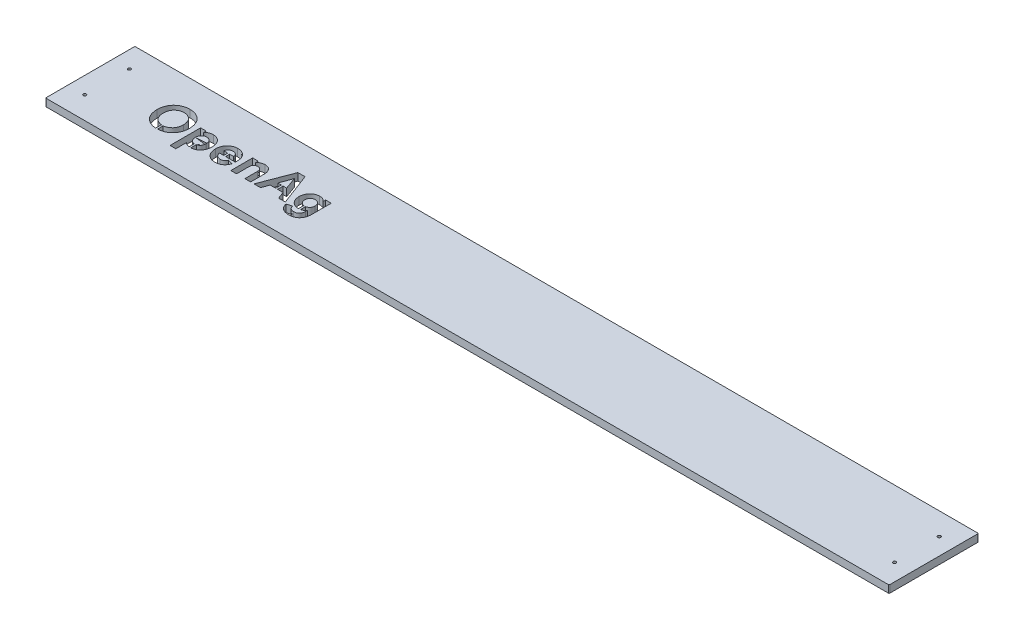
from build123d import *

# Parameters (mm, degrees)
SKETCH1_W                       = 1439.06875
SKETCH1_H                       = 152.4
BOSS_EXTRUDE1_DEPTH             = 12.7
CUT_EXTRUDE1_START              = -12.7
CUT_EXTRUDE1_DEPTH              = 12.7
CUT_EXTRUDE1_2_DEPTH            = 12.7
CUT_EXTRUDE1_3_DEPTH            = 12.7
CUT_EXTRUDE1_4_DEPTH            = 12.7
CUT_EXTRUDE1_5_DEPTH            = 12.7
CUT_EXTRUDE1_6_DEPTH            = 12.7
SKETCH4_W                       = 3.175
SKETCH4_H                       = 6.933464818
SKETCH4_H_2                     = 9.654789964
BOSS_EXTRUDE2_DEPTH             = 12.7
SKETCH6_W                       = 2.5527
SKETCH6_H                       = 12.7005
F_10_CLEARANCE_HOLE1_AT_2_COUNT = 2
F_10_CLEARANCE_HOLE1_AT_2_PITCH = 76.2
F_10_CLEARANCE_HOLE1_AT_3_COUNT = 2
F_10_CLEARANCE_HOLE1_AT_3_PITCH = 1381.53775
F_10_CLEARANCE_HOLE1_AT_4_COUNT = 2
F_10_CLEARANCE_HOLE1_AT_4_PITCH = 1383.637595136
FILLET1_R                       = 1.27


with BuildPart() as part:
    # Sketch1 → Boss-Extrude1 (new body)
    with BuildSketch(Plane(origin=(0, 0, 0), x_dir=(1, 0, 0), z_dir=(0, 1, 0))):
        Rectangle(SKETCH1_W, SKETCH1_H)
    extrude(amount=BOSS_EXTRUDE1_DEPTH)

    # Cut-Extrude1: read off the stored shape, not the designer's step
    # Cut-Extrude1 outline → Cut-Extrude1 (cut)
    with BuildSketch(Plane(origin=(0, 12.7, 0), x_dir=(1, 0, 0), z_dir=(0, 1, 0)).offset(CUT_EXTRUDE1_START)):
        with BuildLine():
            add(Edge.make_bspline(
                [(-551.780401667, 1.668650361), (-551.827730252, 2.779667487), (-551.920081094, 4.947561717), (-552.36913896, 8.092172539), (-553.035642453, 11.045271373), (-553.945017943, 13.800583556), (-555.113751057, 16.352952069), (-556.499009185, 18.71730383), (-558.148142554, 20.869484112), (-560.012129529, 22.814369598), (-562.043963828, 24.552598477), (-564.217847515, 26.055813795), (-566.500187034, 27.342688771), (-568.899085055, 28.410338793), (-571.426107896, 29.219768884), (-574.058331807, 29.81667496), (-576.80690109, 30.189590968), (-578.678880612, 30.242403178), (-579.631574087, 30.269280527)],
                knots=[0, 0, 0, 0, 0.074451698, 0.145275354, 0.212435047, 0.277026598, 0.339247025, 0.400149219, 0.460197701, 0.520422419, 0.580293641, 0.639001946, 0.697181776, 0.755576162, 0.814566439, 0.874625005, 0.936193779, 1, 1, 1, 1], degree=3))
            add(Edge.make_bspline(
                [(-579.631574087, 30.269280527), (-580.580596553, 30.242403196), (-582.445262357, 30.189593865), (-585.182889168, 29.816724378), (-587.804026451, 29.219619511), (-590.320479117, 28.41080598), (-592.709887928, 27.339359027), (-594.989053596, 26.05955276), (-597.154037116, 24.548697395), (-599.185194957, 22.814872165), (-601.048993979, 20.8694434), (-602.697236606, 18.716964514), (-604.085550493, 16.355700015), (-605.238945284, 13.797790122), (-606.147925914, 11.044079391), (-606.831509792, 8.093797267), (-607.275924262, 4.947344025), (-607.36894565, 2.779593725), (-607.416617882, 1.668650361)],
                knots=[0, 0, 0, 0, 0.063651868, 0.125064965, 0.184969653, 0.243810466, 0.302063601, 0.360327161, 0.418917648, 0.478875035, 0.539186426, 0.599321328, 0.660311171, 0.7225192, 0.787203709, 0.854515571, 0.925441154, 1, 1, 1, 1], degree=3))
            Line((-607.416617882, 1.668650361), (-607.405607208, 1.676744229))
            add(Edge.make_bspline(
                [(-607.405607208, 1.676744229), (-607.362981179, 0.56666369), (-607.28004229, -1.593257081), (-606.829215936, -4.726852945), (-606.15038728, -7.659921304), (-605.236396522, -10.397425572), (-604.085705946, -12.94154698), (-602.697186075, -15.292035195), (-601.048045612, -17.432395297), (-599.189144597, -19.36911496), (-597.146368674, -21.077205409), (-594.992762301, -22.59218391), (-592.709177686, -23.859153484), (-590.317873035, -24.916201168), (-587.805914325, -25.732218166), (-585.181130627, -26.31011784), (-582.445514042, -26.688050022), (-580.580681443, -26.740144657), (-579.631574087, -26.766658243)],
                knots=[0, 0, 0, 0, 0.074679285, 0.145305977, 0.212557996, 0.276947572, 0.339097607, 0.400038707, 0.460138845, 0.520433742, 0.580232384, 0.638980237, 0.697279435, 0.755589107, 0.814587958, 0.874599129, 0.936177172, 1, 1, 1, 1], degree=3))
            add(Edge.make_bspline(
                [(-579.631574087, -26.766658243), (-578.678796075, -26.740144742), (-576.806650443, -26.688047471), (-574.060083368, -26.310065667), (-571.42422787, -25.732371548), (-568.9016789, -24.91572744), (-566.50092333, -23.862458879), (-564.214127552, -22.58846031), (-562.051654522, -21.081077871), (-560.008179286, -19.368613543), (-558.149091781, -17.43243533), (-556.499057175, -15.292376189), (-555.113598728, -12.938790008), (-553.947546219, -10.40022293), (-553.033371644, -7.661104411), (-552.370716796, -4.725265645), (-551.919140999, -1.595772685), (-551.827466232, 0.561259623), (-551.780401667, 1.668650361)],
                knots=[0, 0, 0, 0, 0.06398796, 0.1257321, 0.185907606, 0.245065904, 0.303527205, 0.361752053, 0.420627577, 0.480349956, 0.540567957, 0.600591448, 0.661454828, 0.723628057, 0.787935517, 0.855045975, 0.925582596, 1, 1, 1, 1], degree=3))
        make_face()
        with BuildLine():
            add(Edge.make_bspline(
                [(-330.194412628, -21.759384576), (-330.208076706, -22.212640523), (-330.234420309, -23.086493487), (-330.348511142, -24.349033425), (-330.562199308, -25.516234473), (-330.842828665, -26.594743382), (-331.205092001, -27.582283137), (-331.649497195, -28.472599023), (-332.16824851, -29.276871133), (-332.779649263, -29.985132757), (-333.466114792, -30.605302794), (-334.224179227, -31.136047772), (-335.044670216, -31.594410339), (-335.944716081, -31.958214676), (-336.915046175, -32.227453117), (-337.950543377, -32.42657124), (-339.056215692, -32.551866299), (-339.819441942, -32.55982935), (-340.212888501, -32.563934338)],
                knots=[0, 0, 0, 0, 0.080485407, 0.155171513, 0.224755314, 0.290873224, 0.352772413, 0.411099132, 0.467169437, 0.522198618, 0.57668027, 0.630958603, 0.686126708, 0.743163262, 0.802819978, 0.86459194, 0.930196537, 1, 1, 1, 1], degree=3))
            add(Edge.make_bspline(
                [(-340.212888501, -32.563934338), (-340.792226651, -32.53190261), (-341.909992615, -32.470101094), (-343.499373221, -32.06378618), (-344.925730518, -31.424871087), (-346.157413157, -30.527153426), (-347.202802671, -29.443384083), (-348.024950233, -28.18235562), (-348.625590947, -26.762433296), (-348.834379364, -25.746615916), (-348.941866956, -25.223657001)],
                knots=[0, 0, 0, 0, 0.139100388, 0.268378112, 0.391588743, 0.512334912, 0.632171462, 0.751372702, 0.872002719, 1, 1, 1, 1], degree=3))
            Line((-348.941866956, -25.223657001), (-357.703920487, -27.747469307))
            add(Edge.make_bspline(
                [(-357.703920487, -27.747469307), (-357.631334722, -28.216796793), (-357.487756269, -29.145151205), (-357.065147311, -30.481688653), (-356.583671059, -31.782938149), (-355.943128129, -33.01512336), (-355.207371288, -34.207907848), (-354.327153338, -35.323572678), (-353.355239754, -36.407367077), (-352.256135514, -37.410463244), (-351.055321054, -38.345300439), (-349.743771427, -39.153396815), (-348.34198851, -39.859360157), (-346.840552198, -40.427104684), (-345.239539697, -40.880048936), (-343.548201296, -41.217280726), (-341.7579574, -41.443912491), (-340.533195192, -41.489785876), (-339.904288253, -41.513341542)],
                knots=[0, 0, 0, 0, 0.057804303, 0.114339947, 0.170478657, 0.226758305, 0.283295723, 0.341073517, 0.399726364, 0.460579359, 0.522206872, 0.58496307, 0.648050758, 0.713256672, 0.780308064, 0.850658248, 0.923314041, 1, 1, 1, 1], degree=3))
            add(Edge.make_bspline(
                [(-339.904288253, -41.513341542), (-339.065663127, -41.474736612), (-337.441481474, -41.399969688), (-335.098863428, -41.081727674), (-332.93499337, -40.589566318), (-330.956283349, -39.922064403), (-329.157776173, -39.077050029), (-327.53687691, -38.064005697), (-326.102809853, -36.864772629), (-324.864395273, -35.496540901), (-323.809191224, -34.004478723), (-322.871066338, -32.442638843), (-322.086883329, -30.797241637), (-321.461544797, -29.071470311), (-320.972774493, -27.276408835), (-320.634365571, -25.403410693), (-320.42810269, -23.453935729), (-320.42165601, -22.127148702), (-320.418386852, -21.454325395)],
                knots=[0, 0, 0, 0, 0.079343893, 0.153666867, 0.223179338, 0.28886527, 0.350705422, 0.410646399, 0.46908409, 0.526865694, 0.584606567, 0.641614603, 0.698944474, 0.756634132, 0.814942644, 0.874623406, 0.936420621, 1, 1, 1, 1], degree=3))
            Line((-320.418386852, -21.454325395), (-320.407376178, 11.940630059))
            Line((-320.407376178, 11.940630059), (-329.970292128, 11.940630059))
            Line((-329.970292128, 11.940630059), (-329.970292128, 7.56393545))
            add(Edge.make_bspline(
                [(-329.970292128, 7.56393545), (-330.156907671, 7.87224054), (-330.548665477, 8.519458472), (-331.359173892, 9.399482658), (-332.379252785, 10.224386094), (-333.590408458, 11.012413169), (-335.032369198, 11.691551732), (-336.712507645, 12.176894135), (-338.615072274, 12.483265346), (-339.958153404, 12.539346764), (-340.664767436, 12.568851993)],
                knots=[0, 0, 0, 0, 0.087325061, 0.183319535, 0.288495879, 0.405266888, 0.533344086, 0.673874503, 0.82842075, 1, 1, 1, 1], degree=3))
            add(Edge.make_bspline(
                [(-340.664767436, 12.568851993), (-341.293996032, 12.536042229), (-342.529107966, 12.47163999), (-344.328534382, 12.185225727), (-346.026411257, 11.731146727), (-347.625651345, 11.121324189), (-349.130876617, 10.359424486), (-350.538006868, 9.442280903), (-351.839904908, 8.359196277), (-353.029511776, 7.130342209), (-354.10263664, 5.791742156), (-355.049253419, 4.374684804), (-355.84057106, 2.879120656), (-356.506995798, 1.321712009), (-357.028603935, -0.309227731), (-357.397217986, -2.014901743), (-357.648893878, -3.790800416), (-357.692708514, -5.002134769), (-357.714931161, -5.616519789)],
                knots=[0, 0, 0, 0, 0.068033158, 0.133542191, 0.196407075, 0.257584351, 0.318109328, 0.37832251, 0.438640237, 0.500666422, 0.562772549, 0.623753835, 0.684476275, 0.745292026, 0.806542638, 0.869133818, 0.933625079, 1, 1, 1, 1], degree=3))
            add(Edge.make_bspline(
                [(-357.714931161, -5.616519789), (-357.687823882, -6.263780425), (-357.634815039, -7.529511959), (-357.393538079, -9.386064566), (-356.992076123, -11.149845348), (-356.469654247, -12.832301603), (-355.78890245, -14.421102334), (-354.974958856, -15.920285777), (-354.017237787, -17.335678443), (-352.924450584, -18.646496725), (-351.71035698, -19.839715921), (-350.401686433, -20.889093366), (-348.994901764, -21.778488917), (-347.50631655, -22.523301909), (-345.915940531, -23.092105907), (-344.24575591, -23.524120692), (-342.4848688, -23.804652423), (-341.279311754, -23.861224771), (-340.664767436, -23.89006307)],
                knots=[0, 0, 0, 0, 0.0696547, 0.136211204, 0.201012206, 0.263995172, 0.325424561, 0.386601819, 0.447206014, 0.50892699, 0.569838258, 0.63000421, 0.688977651, 0.748528051, 0.808651171, 0.870273416, 0.933870624, 1, 1, 1, 1], degree=3))
            add(Edge.make_bspline(
                [(-340.664767436, -23.89006307), (-340.016909036, -23.863884857), (-338.772924683, -23.8136188), (-336.997064135, -23.513729656), (-335.397622184, -23.047791155), (-333.988564559, -22.401267359), (-332.767150271, -21.641267921), (-331.724921733, -20.812759068), (-330.848363668, -19.932278874), (-330.415611495, -19.265360585), (-330.205423302, -18.941437658)],
                knots=[0, 0, 0, 0, 0.160991901, 0.309128361, 0.446328588, 0.573791584, 0.69311183, 0.802897067, 0.904266895, 1, 1, 1, 1], degree=3))
            Line((-330.205423302, -18.941437658), (-330.194412628, -21.759384576))
        make_face()
        with BuildLine():
            add(Edge.make_bspline(
                [(-420.570199665, -2.016632021), (-420.582337669, -1.511632841), (-420.606275394, -0.515708714), (-420.748450711, 0.944727779), (-420.98865422, 2.346456124), (-421.340846434, 3.67727488), (-421.79444325, 4.942192497), (-422.347409254, 6.137394423), (-422.999492768, 7.269428072), (-423.759648271, 8.328781135), (-424.623004824, 9.299300476), (-425.606814955, 10.150276259), (-426.706470527, 10.867217678), (-427.919750416, 11.466581838), (-429.244035755, 11.938552018), (-430.682206945, 12.277096993), (-432.228000053, 12.499456883), (-433.29918265, 12.545257175), (-433.851021021, 12.568851993)],
                knots=[0, 0, 0, 0, 0.067822687, 0.133755169, 0.196861751, 0.258613351, 0.318385884, 0.377104522, 0.435241969, 0.493571703, 0.551918127, 0.609286345, 0.667718235, 0.727734622, 0.790626756, 0.85608495, 0.925859656, 1, 1, 1, 1], degree=3))
            add(Edge.make_bspline(
                [(-433.851021021, 12.568851993), (-434.377247417, 12.554628255), (-435.427990237, 12.526226999), (-436.992702346, 12.276749481), (-438.531153199, 11.852083408), (-440.035396551, 11.273192572), (-441.47450244, 10.529840077), (-442.757061113, 9.550242874), (-443.921620535, 8.4127551), (-444.537664511, 7.514272046), (-444.85041559, 7.058133271)],
                knots=[0, 0, 0, 0, 0.122902229, 0.245405088, 0.369105169, 0.49520358, 0.621544276, 0.746016377, 0.871058471, 1, 1, 1, 1], degree=3))
            Line((-444.85041559, 7.058133271), (-444.847100548, 11.940619296))
            Line((-444.847100548, 11.940619296), (-454.339883992, 11.940619296))
            Line((-454.339883992, 11.940619296), (-454.339883992, -25.355925013))
            Line((-454.339883992, -25.355925013), (-444.552836779, -25.355925013))
            Line((-444.552836779, -25.355925013), (-444.552836779, -4.049409152))
            add(Edge.make_bspline(
                [(-444.552836779, -4.049409152), (-444.532178455, -3.522123238), (-444.492176059, -2.501096549), (-444.108930771, -1.05180963), (-443.540005288, 0.270272535), (-442.715699733, 1.419615697), (-441.688415445, 2.391094028), (-440.426904611, 3.078252424), (-438.986437036, 3.52256813), (-437.958125057, 3.58624427), (-437.421966753, 3.619444789)],
                knots=[0, 0, 0, 0, 0.134313373, 0.260081931, 0.380141779, 0.499831202, 0.618609864, 0.73783187, 0.863306445, 1, 1, 1, 1], degree=3))
            add(Edge.make_bspline(
                [(-437.421966753, 3.619444789), (-437.124076064, 3.609639991), (-436.544616983, 3.590567629), (-435.710113054, 3.482492408), (-434.940610454, 3.302216002), (-434.229781301, 3.073087248), (-433.577432093, 2.781249475), (-432.999740113, 2.407109477), (-432.472903972, 1.991195763), (-431.874071953, 1.335581319), (-431.252413724, 0.402105302), (-430.720162827, -0.86098299), (-430.403346481, -2.265112593), (-430.380239764, -3.245204313), (-430.368246789, -3.753896861)],
                knots=[0, 0, 0, 0, 0.077055822, 0.149889532, 0.217189304, 0.281188707, 0.342838637, 0.401355759, 0.458782792, 0.515926155, 0.630295792, 0.746947577, 0.868659352, 1, 1, 1, 1], degree=3))
            Line((-430.368246789, -3.753896861), (-430.357236115, -25.355925013))
            Line((-430.357236115, -25.355925013), (-420.570199665, -25.355925013))
            Line((-420.570199665, -25.355925013), (-420.570199665, -2.016632021))
        make_face()
        with BuildLine():
            add(Edge.make_bspline(
                [(-499.494702435, -6.29984891), (-499.460004872, -7.083482927), (-499.392309773, -8.612356396), (-499.075120824, -10.830048935), (-498.621574327, -12.921771619), (-497.977603052, -14.871232597), (-497.191158731, -16.697594716), (-496.204459701, -18.368230887), (-495.0856572, -19.924427757), (-493.786598551, -21.317108949), (-492.386593125, -22.571647159), (-490.884764981, -23.654134814), (-489.317901044, -24.594831128), (-487.657175436, -25.333001486), (-485.935613843, -25.942648834), (-484.132212273, -26.366180093), (-482.250682404, -26.639009566), (-480.968617349, -26.679806897), (-480.317401283, -26.700529618)],
                knots=[0, 0, 0, 0, 0.075045359, 0.14641383, 0.214157799, 0.279660286, 0.342647738, 0.404109771, 0.465025079, 0.52575128, 0.586029825, 0.644695714, 0.702716141, 0.760634164, 0.818356476, 0.877296829, 0.937673774, 1, 1, 1, 1], degree=3))
            add(Edge.make_bspline(
                [(-480.317401283, -26.700529618), (-479.754846288, -26.678335434), (-478.652584578, -26.634848486), (-477.041813517, -26.449283234), (-475.51392159, -26.149217279), (-474.068224603, -25.755504544), (-472.70209971, -25.258532631), (-471.419153452, -24.653907869), (-470.223930901, -23.930808237), (-469.112794582, -23.116062737), (-468.089516295, -22.221954505), (-467.153638664, -21.272371932), (-466.296042187, -20.281745474), (-465.54802487, -19.22336456), (-464.870762007, -18.127578259), (-464.300707942, -16.968276008), (-463.794849876, -15.772904853), (-463.546210646, -14.939651885), (-463.421537682, -14.521841243)],
                knots=[0, 0, 0, 0, 0.075223014, 0.147390831, 0.216431138, 0.283134387, 0.347440037, 0.410471619, 0.472360797, 0.533835709, 0.594388064, 0.653756412, 0.711910439, 0.769271456, 0.826783568, 0.883872876, 0.941771407, 1, 1, 1, 1], degree=3))
            Line((-463.421537682, -14.521841243), (-471.708367065, -11.968903927))
            add(Edge.make_bspline(
                [(-471.708367065, -11.968903927), (-471.868820488, -12.388634518), (-472.182535052, -13.209281391), (-472.862489616, -14.324765007), (-473.670748622, -15.32028781), (-474.641445376, -16.178790422), (-475.777286914, -16.888849648), (-477.108403503, -17.378552026), (-478.612973524, -17.692504136), (-479.680106723, -17.730944723), (-480.240251221, -17.751122414)],
                knots=[0, 0, 0, 0, 0.121317898, 0.237197754, 0.35157679, 0.467021279, 0.586148828, 0.711637701, 0.848636932, 1, 1, 1, 1], degree=3))
            add(Edge.make_bspline(
                [(-480.240251221, -17.751122414), (-480.556512438, -17.737317471), (-481.180152329, -17.710095311), (-482.095855887, -17.591251574), (-482.971718553, -17.388177169), (-483.814720674, -17.12599473), (-484.620685237, -16.784786709), (-485.382448899, -16.363258104), (-486.102622105, -15.872914847), (-486.786710765, -15.326128063), (-487.409855638, -14.712492624), (-487.965819493, -14.049275835), (-488.439400072, -13.33650044), (-488.854147523, -12.589443968), (-489.17237208, -11.782943308), (-489.42060502, -10.937517428), (-489.620746502, -10.047818296), (-489.670975941, -9.434671539), (-489.696644548, -9.121336896)],
                knots=[0, 0, 0, 0, 0.067060551, 0.132237633, 0.195312054, 0.25735482, 0.319094052, 0.380414709, 0.441517565, 0.503521248, 0.565724968, 0.626524582, 0.686546771, 0.746810783, 0.807235473, 0.869793771, 0.933461081, 1, 1, 1, 1], degree=3))
            Line((-489.696644548, -9.121336896), (-463.042374403, -9.115847703))
            add(Edge.make_bspline(
                [(-463.042374403, -9.115847703), (-463.040079705, -9.077270853), (-463.033198686, -8.961591993), (-463.025242306, -8.742692114), (-462.999875884, -8.423229513), (-462.954015417, -7.85816389), (-462.9027747, -7.039087624), (-462.903270405, -6.358732427), (-462.903530122, -6.002270099)],
                knots=[0, 0, 0, 0, 0.037185265, 0.111505968, 0.210740262, 0.345491102, 0.65707947, 1, 1, 1, 1], degree=3))
            add(Edge.make_bspline(
                [(-462.903530122, -6.002270099), (-462.92207503, -5.270567998), (-462.958141946, -3.847522951), (-463.19140361, -1.771804144), (-463.574140511, 0.178613484), (-464.102974198, 2.014161632), (-464.784488892, 3.724463792), (-465.616342255, 5.312218567), (-466.590130834, 6.779338682), (-467.715012305, 8.113645033), (-468.97887761, 9.306969463), (-470.358180245, 10.363392253), (-471.872054231, 11.245802703), (-473.502239313, 11.982553667), (-475.266785726, 12.534303629), (-477.145332616, 12.957913396), (-479.149787844, 13.210382943), (-480.526104426, 13.252577429), (-481.232180591, 13.274223989)],
                knots=[0, 0, 0, 0, 0.072853418, 0.141688394, 0.20768907, 0.270548519, 0.331615563, 0.390683259, 0.448715662, 0.506606085, 0.564049829, 0.621481924, 0.679199887, 0.73814399, 0.799225275, 0.86294628, 0.929688876, 1, 1, 1, 1], degree=3))
            add(Edge.make_bspline(
                [(-481.232180591, 13.274223989), (-481.843012356, 13.248978417), (-483.044474794, 13.19932218), (-484.812564577, 12.927380851), (-486.513148324, 12.503066039), (-488.144053937, 11.896147687), (-489.715745449, 11.152248595), (-491.208071967, 10.225422614), (-492.63917056, 9.152233036), (-493.98357636, 7.921517813), (-495.23501355, 6.567006369), (-496.311434923, 5.062461905), (-497.264443707, 3.464377059), (-498.016300261, 1.724753408), (-498.640612728, -0.116050567), (-499.084240547, -2.078051836), (-499.389346928, -4.149218379), (-499.459015172, -5.571361919), (-499.494702435, -6.29984891)],
                knots=[0, 0, 0, 0, 0.061486627, 0.120939802, 0.179675867, 0.237577458, 0.295788681, 0.354381438, 0.414056083, 0.475561605, 0.537589439, 0.599268078, 0.661411507, 0.724479657, 0.789603779, 0.856778944, 0.926635622, 1, 1, 1, 1], degree=3))
        make_face()
        with BuildLine():
            add(Edge.make_bspline(
                [(-505.225849906, -6.597427721), (-505.240611593, -5.917130724), (-505.269497108, -4.585932717), (-505.496848266, -2.640734406), (-505.849709041, -0.78769946), (-506.328077256, 0.978404434), (-506.959800684, 2.648242531), (-507.724511208, 4.222817568), (-508.620301833, 5.70906558), (-509.65083655, 7.092423039), (-510.807922062, 8.355277139), (-512.091776234, 9.466496518), (-513.505805606, 10.406546092), (-515.029243769, 11.195733214), (-516.679859289, 11.799093014), (-518.440041456, 12.252421001), (-520.323798026, 12.539391626), (-521.621094498, 12.602556317), (-522.287035068, 12.634980618)],
                knots=[0, 0, 0, 0, 0.070582608, 0.138115304, 0.202943194, 0.266208517, 0.327743087, 0.387934271, 0.447630784, 0.507564231, 0.566653803, 0.625044314, 0.68330773, 0.742475967, 0.802671981, 0.865274435, 0.930841391, 1, 1, 1, 1], degree=3))
            add(Edge.make_bspline(
                [(-522.287035068, 12.634980618), (-522.968161968, 12.610558347), (-524.286734724, 12.56328002), (-526.177995799, 12.233483573), (-527.917672955, 11.745707015), (-529.476880372, 11.063503143), (-530.84618548, 10.244349925), (-532.026209623, 9.345745994), (-533.001393003, 8.345479642), (-533.488789319, 7.592104274), (-533.727287135, 7.223454833)],
                knots=[0, 0, 0, 0, 0.154663793, 0.299408912, 0.434906485, 0.564215429, 0.684725803, 0.796567498, 0.9004543, 1, 1, 1, 1], degree=3))
            Line((-533.727287135, 7.223454833), (-533.723972093, 11.940630059))
            Line((-533.723972093, 11.940630059), (-543.216755537, 11.940630059))
            Line((-543.216755537, 11.940630059), (-543.216755537, -40.168736937))
            Line((-543.216755537, -40.168736937), (-533.429708324, -40.168736937))
            Line((-533.429708324, -40.168736937), (-533.429708324, -21.482363329))
            add(Edge.make_bspline(
                [(-533.429708324, -21.482363329), (-533.181959561, -21.801238467), (-532.673498632, -22.45567382), (-531.701231181, -23.301350911), (-530.572742792, -24.072417503), (-529.281596712, -24.756143246), (-527.832800967, -25.316480456), (-526.237226005, -25.736890951), (-524.495098738, -25.985217375), (-523.287096391, -26.035339904), (-522.661763941, -26.061286247)],
                knots=[0, 0, 0, 0, 0.099746851, 0.204712935, 0.317203959, 0.437608677, 0.565438102, 0.700862265, 0.845148867, 1, 1, 1, 1], degree=3))
            add(Edge.make_bspline(
                [(-522.661763941, -26.061286247), (-522.013851082, -26.03476652), (-520.744386904, -25.982806071), (-518.897595383, -25.670718132), (-517.147078616, -25.229512999), (-515.506787225, -24.602288262), (-513.959526947, -23.836156631), (-512.534549371, -22.873954112), (-511.200427521, -21.767011503), (-509.982699013, -20.498357123), (-508.884283429, -19.101927728), (-507.921057588, -17.601138261), (-507.11535427, -15.998203715), (-506.438680225, -14.307221118), (-505.911521814, -12.513365826), (-505.525374469, -10.626220509), (-505.295303366, -8.641872998), (-505.249333262, -7.288688282), (-505.225849906, -6.597427721)],
                knots=[0, 0, 0, 0, 0.066422107, 0.130141708, 0.191625588, 0.251228923, 0.309849413, 0.368246816, 0.427083517, 0.487286063, 0.548171692, 0.60898271, 0.669793727, 0.731834657, 0.79547628, 0.861221037, 0.929106187, 1, 1, 1, 1], degree=3))
        make_face()
        Polygon((-399.209502245, -13.29847245), (-377.269264494, -13.29847245), (-372.774563011, -25.355925013), (-361.347355849, -25.355925013), (-381.91632874, 28.869547209), (-394.105349713, 28.869547209), (-414.826685367, -25.355925013), (-403.704203729, -25.355925013), align=None)
    extrude(amount=CUT_EXTRUDE1_DEPTH, mode=Mode.SUBTRACT)



with BuildPart() as body_2:
    # Cut-Extrude1 2 outline → Cut-Extrude1 2 (new body)
    with BuildSketch(Plane(origin=(0, 12.7, 0), x_dir=(1, 0, 0), z_dir=(0, 1, 0)).offset(CUT_EXTRUDE1_START)):
        with BuildLine():
            add(Edge.make_bspline(
                [(-338.912358883, 3.619444789), (-338.603190193, 3.61173758), (-337.996618037, 3.596616456), (-337.11258031, 3.455442117), (-336.268768599, 3.257059472), (-335.456375447, 2.995502425), (-334.686972887, 2.644192331), (-333.966150335, 2.205137315), (-333.277249345, 1.707696789), (-332.630251786, 1.140195678), (-332.045876629, 0.501081477), (-331.533937631, -0.202181602), (-331.092896145, -0.962394891), (-330.728284424, -1.782930824), (-330.441711293, -2.658307888), (-330.231946246, -3.591880807), (-330.102009704, -4.584516194), (-330.068350354, -5.267144246), (-330.051123178, -5.616519789)],
                knots=[0, 0, 0, 0, 0.064659137, 0.12685771, 0.186909188, 0.24599303, 0.30517185, 0.363454809, 0.422358272, 0.482826693, 0.543236426, 0.603214025, 0.664536754, 0.726835046, 0.790781677, 0.856999198, 0.926810826, 1, 1, 1, 1], degree=3))
            add(Edge.make_bspline(
                [(-347.916873274, -5.616519789), (-347.905632001, -5.266904552), (-347.883645449, -4.583100001), (-347.731818735, -3.592914932), (-347.527339643, -2.658198912), (-347.239583293, -1.782861985), (-346.874622601, -0.962761806), (-346.434953068, -0.198921168), (-345.910576048, 0.501512242), (-345.315829549, 1.136731968), (-344.667704229, 1.711111941), (-343.966526933, 2.208291318), (-343.227569817, 2.641293736), (-342.445506047, 2.995879014), (-341.618626202, 3.258681084), (-340.755983701, 3.455161873), (-339.850045402, 3.596651398), (-339.228866481, 3.611751086), (-338.912358883, 3.619444789)],
                knots=[0, 0, 0, 0, 0.072494265, 0.141789896, 0.20741855, 0.270796509, 0.332540788, 0.39331818, 0.453214937, 0.513604124, 0.573534805, 0.632532864, 0.691609614, 0.750956067, 0.810238882, 0.871240395, 0.93439347, 1, 1, 1, 1], degree=3))
            add(Edge.make_bspline(
                [(-338.907876158, -14.929531185), (-339.236910652, -14.922043042), (-339.881533432, -14.907181292), (-340.818062495, -14.765246878), (-341.705585024, -14.573756744), (-342.542707868, -14.292549858), (-343.331477632, -13.940841519), (-344.082143857, -13.524565159), (-344.762421412, -13.007252869), (-345.404871327, -12.439966089), (-345.980050642, -11.795271149), (-346.487149051, -11.090331819), (-346.922003593, -10.32266601), (-347.272255496, -9.493248712), (-347.549287729, -8.607280307), (-347.743218522, -7.661649926), (-347.880637841, -6.660050749), (-347.904610149, -5.969681025), (-347.916873274, -5.616519789)],
                knots=[0.000310705, 0.000310705, 0.000310705, 0.000310705, 0.067913332, 0.132756461, 0.194696793, 0.254414028, 0.313930274, 0.372113374, 0.430428714, 0.489270042, 0.54811137, 0.607646787, 0.667516703, 0.729110623, 0.792422158, 0.858052459, 0.9273862, 1, 1, 1, 1], degree=3))
            add(Edge.make_bspline(
                [(-330.051123178, -5.616519789), (-330.06475034, -5.965826316), (-330.091365538, -6.648056561), (-330.209641887, -7.640796538), (-330.411085857, -8.577018759), (-330.680454791, -9.458390234), (-331.043064188, -10.279855604), (-331.453630772, -11.055826585), (-331.958437311, -11.762563964), (-332.518388049, -12.416956925), (-333.146469565, -12.996830577), (-333.822834184, -13.511392883), (-334.553409418, -13.939801845), (-335.331675133, -14.296831592), (-336.160152625, -14.571551092), (-337.035998226, -14.764506344), (-337.954779366, -14.907384048), (-338.585488545, -14.92210564), (-338.907876158, -14.929531185)],
                knots=[0, 0, 0, 0, 0.07251333, 0.141625716, 0.207107687, 0.27099531, 0.332449322, 0.393161407, 0.452796891, 0.512242088, 0.571569882, 0.629805462, 0.688240242, 0.746908215, 0.807168832, 0.868929349, 0.932853339, 0.999690216, 0.999690216, 0.999690216, 0.999690216], degree=3))
        make_face()
    extrude(amount=CUT_EXTRUDE1_2_DEPTH)


with BuildPart() as body_3:
    # Cut-Extrude1 3 outline → Cut-Extrude1 3 (new body)
    with BuildSketch(Plane(origin=(0, 12.7, 0), x_dir=(1, 0, 0), z_dir=(0, 1, 0)).offset(CUT_EXTRUDE1_START)):
        Polygon((-395.705158716, -3.643682486), (-380.773608024, -3.643682486), (-388.23938337, 17.052725775), align=None)
    extrude(amount=CUT_EXTRUDE1_3_DEPTH)


with BuildPart() as body_4:
    # Cut-Extrude1 4 outline → Cut-Extrude1 4 (new body)
    with BuildSketch(Plane(origin=(0, 12.7, 0), x_dir=(1, 0, 0), z_dir=(0, 1, 0)).offset(CUT_EXTRUDE1_START)):
        with BuildLine():
            add(Edge.make_bspline(
                [(-524.259872371, 3.564337602), (-523.93613608, 3.556132808), (-523.300563413, 3.540024812), (-522.36946739, 3.405403011), (-521.481905021, 3.180798496), (-520.634454455, 2.887707021), (-519.829337673, 2.506706624), (-519.070821785, 2.046390957), (-518.357811775, 1.495716555), (-517.68587694, 0.874850808), (-517.087030239, 0.164790702), (-516.529970845, -0.59692236), (-516.090032818, -1.450419212), (-515.706797949, -2.362585263), (-515.416355999, -3.342980559), (-515.188583857, -4.391896186), (-515.065261597, -5.510966872), (-515.030590623, -6.281245388), (-515.012886356, -6.674577783)],
                knots=[0, 0, 0, 0, 0.062676051, 0.123048253, 0.181719486, 0.239774892, 0.296426911, 0.353899534, 0.411248713, 0.47064881, 0.530688889, 0.590901564, 0.652968899, 0.716127699, 0.782300394, 0.850677816, 0.923750629, 1, 1, 1, 1], degree=3))
            add(Edge.make_bspline(
                [(-533.584008448, -6.553341972), (-533.568281368, -6.163393986), (-533.537763368, -5.406709809), (-533.388382862, -4.305725439), (-533.178932849, -3.269155749), (-532.857942918, -2.304889155), (-532.495241284, -1.395210878), (-532.023475771, -0.564467356), (-531.48269853, 0.201936489), (-530.864954778, 0.892523854), (-530.190898359, 1.515080933), (-529.462017868, 2.050402919), (-528.699793399, 2.521301754), (-527.892507625, 2.895972881), (-527.040620043, 3.182160056), (-526.153695874, 3.404300859), (-525.219212748, 3.540180136), (-524.583619265, 3.556185225), (-524.259872371, 3.564337602)],
                knots=[0, 0, 0, 0, 0.075825603, 0.147137659, 0.215774509, 0.281047967, 0.344446395, 0.405837891, 0.466279016, 0.526479145, 0.5856193, 0.644326631, 0.702017309, 0.759530885, 0.816897941, 0.876484896, 0.937086153, 1, 1, 1, 1], degree=3))
            add(Edge.make_bspline(
                [(-524.259872371, -16.990643231), (-524.583591484, -16.977894268), (-525.21894976, -16.952872085), (-526.153474748, -16.819510672), (-527.042724674, -16.599897054), (-527.892897575, -16.299414745), (-528.699949259, -15.913946523), (-529.465598125, -15.433038468), (-530.191264904, -14.874122147), (-530.865012909, -14.229848158), (-531.486867348, -13.516299228), (-532.020323544, -12.719320185), (-532.49566026, -11.865479036), (-532.859946712, -10.930673906), (-533.178546445, -9.936140095), (-533.388401167, -8.866906913), (-533.537657958, -7.732907304), (-533.568253283, -6.954292343), (-533.584008448, -6.553341972)],
                knots=[0, 0, 0, 0, 0.061922463, 0.121534218, 0.180148234, 0.236809897, 0.293684565, 0.350801697, 0.40939887, 0.468532643, 0.528807206, 0.589991993, 0.651610834, 0.715274279, 0.781491345, 0.85107032, 0.923308165, 1, 1, 1, 1], degree=3))
            add(Edge.make_bspline(
                [(-515.001886444, -6.543569056), (-515.023770472, -6.951172651), (-515.066078904, -7.739193449), (-515.190567417, -8.886837516), (-515.414466743, -9.958702795), (-515.708074727, -10.963507806), (-516.083691263, -11.894302813), (-516.536952114, -12.754875791), (-517.082684302, -13.53486655), (-517.686065894, -14.256567536), (-518.357978967, -14.887859632), (-519.067110925, -15.452050847), (-519.832291631, -15.909110132), (-520.633873405, -16.301992992), (-521.478151099, -16.61274939), (-522.371466282, -16.816922481), (-523.30058415, -16.953723508), (-523.936082095, -16.97818165), (-524.259872371, -16.990643231)],
                knots=[0, 0, 0, 0, 0.078166997, 0.151120403, 0.220797993, 0.28757749, 0.351331164, 0.41270356, 0.47339474, 0.533297903, 0.592515486, 0.649652965, 0.706482095, 0.762803811, 0.820445816, 0.878293532, 0.937989775, 1, 1, 1, 1], degree=3))
            Line((-515.001886444, -6.543569056), (-515.012886356, -6.674577783))
        make_face()
    extrude(amount=CUT_EXTRUDE1_4_DEPTH)


with BuildPart() as body_5:
    # Cut-Extrude1 5 outline → Cut-Extrude1 5 (new body)
    with BuildSketch(Plane(origin=(0, 12.7, 0), x_dir=(1, 0, 0), z_dir=(0, 1, 0)).offset(CUT_EXTRUDE1_START)):
        with BuildLine():
            add(Edge.make_bspline(
                [(-579.631574087, -16.979621793), (-580.179583452, -16.96768046), (-581.265013854, -16.944028516), (-582.871890669, -16.731604071), (-584.426418661, -16.36344096), (-585.941975686, -15.86642002), (-587.404740816, -15.217667922), (-588.815762252, -14.410812619), (-590.182459416, -13.474495678), (-591.496618504, -12.39932524), (-592.712524938, -11.167135534), (-593.78599067, -9.77417769), (-594.696119579, -8.219703721), (-595.453981083, -6.518722483), (-596.061319965, -4.664530456), (-596.506322752, -2.663683181), (-596.809437624, -0.511062829), (-596.877843077, 0.976948693), (-596.913187998, 1.745800423)],
                knots=[0, 0, 0, 0, 0.057526231, 0.113940974, 0.169804332, 0.225066394, 0.281195517, 0.337513893, 0.39550904, 0.454978875, 0.515538535, 0.576880729, 0.63913799, 0.704237084, 0.772064524, 0.843657762, 0.919218368, 1, 1, 1, 1], degree=3))
            add(Edge.make_bspline(
                [(-562.272810113, 1.745800423), (-562.308146238, 0.976943061), (-562.376534666, -0.511079363), (-562.679768834, -2.66362333), (-563.124354702, -4.664737558), (-563.733136946, -6.518005401), (-564.486710918, -8.223937341), (-565.414770524, -9.766540219), (-566.471308354, -11.175116153), (-567.701177313, -12.395316283), (-569.01439139, -13.474091259), (-570.38461425, -14.418206108), (-571.808310639, -15.207854401), (-573.273710597, -15.875051937), (-574.798048966, -16.358466504), (-576.361377756, -16.733705227), (-577.97990415, -16.944086849), (-579.076254959, -16.967674349), (-579.631574087, -16.979621793)],
                knots=[0, 0, 0, 0, 0.080585024, 0.155961729, 0.227380722, 0.295043082, 0.359983736, 0.422285889, 0.483244798, 0.543927341, 0.603252437, 0.661106435, 0.717958555, 0.773599517, 0.829458305, 0.885185702, 0.941844731, 1, 1, 1, 1], degree=3))
            add(Edge.make_bspline(
                [(-579.631574087, 20.482244077), (-579.076254959, 20.470296633), (-577.97990415, 20.446709133), (-576.361377756, 20.236327511), (-574.798048966, 19.861088789), (-573.273710596, 19.377674221), (-571.808310641, 18.710476685), (-570.384614242, 17.920828393), (-569.014391419, 16.976713539), (-567.7011772, 15.897938583), (-566.471308789, 14.677738379), (-565.414768882, 13.269162724), (-564.486717309, 11.726558766), (-563.733111543, 10.020631101), (-563.12445613, 8.167346203), (-562.678566873, 6.162744226), (-562.377355586, 4.006229985), (-562.308368604, 2.514628196), (-562.272810113, 1.745800423)],
                knots=[0, 0, 0, 0, 0.05813311, 0.114770551, 0.170476714, 0.226314218, 0.281933979, 0.338764437, 0.39659639, 0.455898882, 0.516558303, 0.577493984, 0.639772398, 0.704688308, 0.772324887, 0.843716667, 0.919445681, 1, 1, 1, 1], degree=3))
            add(Edge.make_bspline(
                [(-596.913187998, 1.756133021), (-596.877483073, 2.521500859), (-596.808061336, 4.009619516), (-596.507544693, 6.16280524), (-596.061213796, 8.167138932), (-595.454007675, 10.021348226), (-594.696112914, 11.722325139), (-593.785992394, 13.276800199), (-592.712524485, 14.66975776), (-591.496618622, 15.901947539), (-590.182459385, 16.977117958), (-588.815762259, 17.913434904), (-587.404740814, 18.720290206), (-585.941975686, 19.369042304), (-584.426418661, 19.866063244), (-582.871890669, 20.234226356), (-581.265013854, 20.446650801), (-580.179583452, 20.470302744), (-579.631574087, 20.482244077)],
                knots=[0, 0, 0, 0, 0.080418974, 0.156360078, 0.227951803, 0.295777809, 0.360875526, 0.42313147, 0.484472367, 0.545030746, 0.604499324, 0.662493245, 0.718810429, 0.774938365, 0.830199259, 0.886061436, 0.942474985, 1, 1, 1, 1], degree=3))
            Line((-596.913187998, 1.756133021), (-596.913187998, 1.745800423))
        make_face()
    extrude(amount=CUT_EXTRUDE1_5_DEPTH)


with BuildPart() as body_6:
    # Cut-Extrude1 6 outline → Cut-Extrude1 6 (new body)
    with BuildSketch(Plane(origin=(0, 12.7, 0), x_dir=(1, 0, 0), z_dir=(0, 1, 0)).offset(CUT_EXTRUDE1_START)):
        with BuildLine():
            add(Edge.make_bspline(
                [(-481.077880467, 5.030188782), (-480.72853279, 5.016955447), (-480.05351123, 4.991385543), (-479.080005597, 4.870879172), (-478.182465778, 4.679923225), (-477.347493752, 4.444612131), (-476.590984616, 4.125674341), (-475.910149487, 3.744782943), (-475.290760717, 3.315496008), (-474.590459634, 2.643549563), (-473.856483322, 1.719059403), (-473.204967543, 0.49907513), (-472.789623009, -0.81462615), (-472.723882778, -1.726651428), (-472.690566572, -2.188852744)],
                knots=[0, 0, 0, 0, 0.084593947, 0.163455325, 0.237052354, 0.306554795, 0.373110694, 0.435210661, 0.495166256, 0.554930309, 0.669503266, 0.779297293, 0.888151037, 1, 1, 1, 1], degree=3))
            add(Edge.make_bspline(
                [(-489.467712932, -2.183342025), (-489.413624641, -1.748147685), (-489.304927813, -0.8735731), (-488.833413686, 0.394817796), (-488.108414368, 1.589807883), (-487.344668063, 2.531859859), (-486.605480152, 3.211059392), (-485.991300499, 3.679332583), (-485.305006642, 4.064418425), (-484.573438785, 4.397023943), (-483.776010639, 4.647882441), (-482.929308123, 4.846796444), (-482.022145253, 4.980132837), (-481.397936536, 5.013222451), (-481.077880467, 5.030188782)],
                knots=[0, 0, 0, 0, 0.107726452, 0.216489067, 0.330074811, 0.450903511, 0.513654165, 0.576989163, 0.640620753, 0.707040897, 0.774567253, 0.846114007, 0.921096671, 1, 1, 1, 1], degree=3))
            Line((-489.467712932, -2.183342025), (-472.690566572, -2.188852744))
        make_face()
    extrude(amount=CUT_EXTRUDE1_6_DEPTH)


with BuildPart() as part_1:
    add(part.part)

    add(body_6.part)  # Boss-Extrude2 merges body 6
    # Sketch4 → Boss-Extrude2 (add)
    with BuildSketch(Plane(origin=(0, 12.7, 0), x_dir=(1, 0, 0), z_dir=(0, 1, 0))):
        with Locations((-481.079139752, -5.652829794)):
            Rectangle(SKETCH4_W, SKETCH4_H)
        with BuildLine():
            Line((-525.112232222, -25.887487661), (-525.112232222, -16.945607403))
            add(Edge.make_bspline(
                [(-524.259872371, -16.990643231), (-524.54427959, -16.97944248), (-524.828686808, -16.96824173), (-525.112232222, -16.945607403)],
                knots=[0, 0, 0, 0, 0.054402705, 0.054402705, 0.054402705, 0.054402705], degree=3))
            add(Edge.make_bspline(
                [(-521.937232222, -16.713789789), (-522.078814284, -16.746808817), (-522.526805627, -16.839794263), (-523.30058415, -16.953723508), (-523.936082095, -16.97818165), (-524.259872371, -16.990643231)],
                knots=[0.850465505, 0.850465505, 0.850465505, 0.850465505, 0.878293532, 0.937989775, 1, 1, 1, 1], degree=3))
            Line((-521.937232222, -16.713789789), (-521.937232222, -26.029461685))
            add(Edge.make_bspline(
                [(-522.661763941, -26.061286247), (-522.420184849, -26.051398171), (-522.178605756, -26.041510095), (-521.937232222, -26.029461685)],
                knots=[0, 0, 0, 0, 0.024765973, 0.024765973, 0.024765973, 0.024765973], degree=3))
            add(Edge.make_bspline(
                [(-525.112232222, -25.887487661), (-524.920302557, -25.911924925), (-524.105715662, -26.001373689), (-523.287096391, -26.035339904), (-522.661763941, -26.061286247)],
                knots=[0.797285233, 0.797285233, 0.797285233, 0.797285233, 0.845148867, 1, 1, 1, 1], degree=3))
        make_face()
        with BuildLine():
            Line((-581.219074097, -26.713144774), (-581.219074097, -16.917623072))
            add(Edge.make_bspline(
                [(-579.631574087, -16.979621793), (-580.161292873, -16.968079018), (-580.691011658, -16.956536244), (-581.219074097, -16.917623072)],
                knots=[0, 0, 0, 0, 0.055606213, 0.055606213, 0.055606213, 0.055606213], degree=3))
            add(Edge.make_bspline(
                [(-578.044074073, -16.919155633), (-578.57224558, -16.956830812), (-579.101909834, -16.968226302), (-579.631574087, -16.979621793)],
                knots=[0.944531413, 0.944531413, 0.944531413, 0.944531413, 1, 1, 1, 1], degree=3))
            Line((-578.044074073, -16.919155633), (-578.044074073, -26.71342153))
            add(Edge.make_bspline(
                [(-579.631574087, -26.766658243), (-579.102191191, -26.751926801), (-578.572808296, -26.737195359), (-578.044074073, -26.71342153)],
                knots=[0, 0, 0, 0, 0.035553016, 0.035553016, 0.035553016, 0.035553016], degree=3))
            add(Edge.make_bspline(
                [(-581.219074097, -26.713144774), (-580.690346016, -26.737081145), (-580.160960051, -26.751869694), (-579.631574087, -26.766658243)],
                knots=[0.964401383, 0.964401383, 0.964401383, 0.964401383, 1, 1, 1, 1], degree=3))
        make_face()
        with Locations((-388.23938337, -8.471077468)):
            Rectangle(SKETCH4_W, SKETCH4_H_2)
        with BuildLine():
            Line((-340.345307119, -23.876964206), (-340.345307119, -14.832992537))
            add(Edge.make_bspline(
                [(-338.907876158, -14.929531185), (-339.236910652, -14.922043042), (-339.717776962, -14.910956691), (-340.195017976, -14.854326039), (-340.345307119, -14.832992537)],
                knots=[0.000310705, 0.000310705, 0.000310705, 0.000310705, 0.067913332, 0.09911066, 0.09911066, 0.09911066, 0.09911066], degree=3))
            add(Edge.make_bspline(
                [(-337.170307119, -14.779364634), (-337.426391653, -14.8247264), (-338.0030959, -14.908511821), (-338.585488545, -14.92210564), (-338.907876158, -14.929531185)],
                knots=[0.878946505, 0.878946505, 0.878946505, 0.878946505, 0.932853339, 0.999690216, 0.999690216, 0.999690216, 0.999690216], degree=3))
            Line((-337.170307119, -14.779364634), (-337.170307119, -23.518014609))
            add(Edge.make_bspline(
                [(-340.345307119, -23.876964206), (-339.804026967, -23.854124951), (-338.738793065, -23.799488016), (-337.683858381, -23.629184497), (-337.170307119, -23.518014609)],
                knots=[0.026463212, 0.026463212, 0.026463212, 0.026463212, 0.160991901, 0.29142795, 0.29142795, 0.29142795, 0.29142795], degree=3))
        make_face()
    extrude(amount=-BOSS_EXTRUDE2_DEPTH)

    # Sketch6 → #10 Clearance Hole1 (revolve, cut)
    with BuildSketch(Plane(origin=(690.768875, 12.7, -38.1), x_dir=(0, 0, 1), z_dir=(1, 0, 0))):
        with Locations((1.27635, 6.35025)):
            Rectangle(SKETCH6_W, SKETCH6_H)
    f_10_clearance_hole1 = revolve(axis=Axis((690.768875, 19.05, -38.1), (0, -1, 0)), mode=Mode.SUBTRACT)

    # #10 Clearance Hole1 at 2: #10 Clearance Hole1 ×2
    with Locations(*[(0, 0, i * F_10_CLEARANCE_HOLE1_AT_2_PITCH) for i in range(1, F_10_CLEARANCE_HOLE1_AT_2_COUNT)]):
        add(f_10_clearance_hole1, mode=Mode.SUBTRACT)

    # #10 Clearance Hole1 at 3: #10 Clearance Hole1 ×2
    with Locations(*[(-i * F_10_CLEARANCE_HOLE1_AT_3_PITCH, 0, 0) for i in range(1, F_10_CLEARANCE_HOLE1_AT_3_COUNT)]):
        add(f_10_clearance_hole1, mode=Mode.SUBTRACT)

    # #10 Clearance Hole1 at 4: #10 Clearance Hole1 ×2
    with Locations(*[Vector(-0.9984823734597403, 0, 0.05507222430775578) * (i * F_10_CLEARANCE_HOLE1_AT_4_PITCH) for i in range(1, F_10_CLEARANCE_HOLE1_AT_4_COUNT)]):
        add(f_10_clearance_hole1, mode=Mode.SUBTRACT)

    # Fillet1
    fillet1_edges = [part_1.edges().sort_by_distance(p)[0] for p in [
        (719.534375, 6.35, 76.2),
        (719.534375, 6.35, -76.2),
        (-719.534375, 6.35, -76.2),
        (-719.534375, 6.35, 76.2),
    ]]
    fillet(fillet1_edges, radius=FILLET1_R)


solid = Compound([body_2.part, body_3.part, body_4.part, body_5.part, part_1.part])
